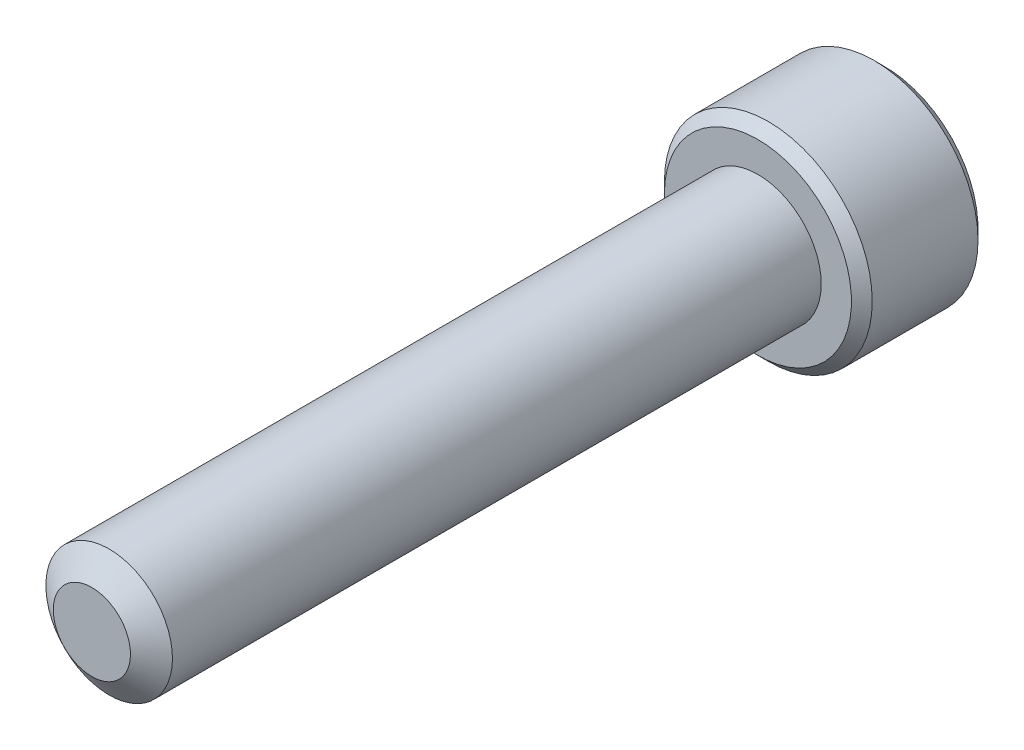
from build123d import *

# Parameters (mm, degrees)
SKETCH1_R            = 2.413
EXTRUDE1_DEPTH       = 25.4
SKETCH6_R            = 3.9624
EXTRUDE2_DEPTH       = 4.826
CUT_EXTRUDE1_DEPTH   = 2.9765625
CHAMFER1_SIZE        = 0.39624
SKETCH10_R           = 2.413
PARTIAL_THREAD_DEPTH = 3.175
CHAMFER2_SIZE        = 0.09652


with BuildPart() as part:
    # Sketch1 → Extrude1 (new body)
    with BuildSketch(Plane.XY):
        Circle(SKETCH1_R)
    extrude(amount=-EXTRUDE1_DEPTH)

    # Sketch4 → Cut-Revolve1 (revolve, cut)
    with BuildSketch(Plane(origin=(0, 0, 0), x_dir=(0, 0, -1), z_dir=(1, 0, 0)), mode=Mode.PRIVATE) as cut_revolve1_sk:
        Polygon((0.659180743, 2.413), (0, 1.471592336), (0, 2.413), align=None)
    revolve(cut_revolve1_sk.sketch.rotate(Axis((0, 0, 0), (0, 0, -1)), 90), axis=Axis((0, 0, 0), (0, 0, -1)), mode=Mode.SUBTRACT)

    # Sketch6 → Extrude2 (add)
    with BuildSketch(Plane(origin=(0, 0, -25.4), x_dir=(-1, 0, 0), z_dir=(0, 0, -1))):
        Circle(SKETCH6_R)
    extrude(amount=EXTRUDE2_DEPTH)

    # Sketch7 → Cut-Extrude1 (cut)
    with BuildSketch(Plane(origin=(0, 0, -30.226), x_dir=(-1, 0, 0), z_dir=(0, 0, -1))):
        Polygon((0, 2.291358881), (-1.984375, 1.14567944), (-1.984375, -1.14567944), (0, -2.291358881), (1.984375, -1.14567944), (1.984375, 1.14567944), align=None)
    extrude(amount=-CUT_EXTRUDE1_DEPTH, mode=Mode.SUBTRACT)

    # Cut-Extrude2 cone 1 section (through the dimple's axis) → Cut-Extrude2 (revolve, cut)
    with BuildSketch(Plane(origin=(0, 0, -30.226), x_dir=(0, 1, 0), z_dir=(1, 0, 0))):
        Polygon((0, 0), (2.291358881, 0), (0, 2.291358881), align=None)
    revolve(axis=Axis((0, 0, -30.226), (0, 0, 1)), mode=Mode.SUBTRACT)

    # Chamfer1
    chamfer1_edges = [part.edges().sort_by_distance(p)[0] for p in [
        (3.9624, 0, -25.4),
        (3.9624, 0, -30.226),
    ]]
    chamfer(chamfer1_edges, length=CHAMFER1_SIZE)


with BuildPart() as body_2:
    # Sketch10 → partial thread (new body)
    with BuildSketch(Plane.XY.offset(-25.4)):
        Circle(SKETCH10_R)
    extrude(amount=PARTIAL_THREAD_DEPTH)

    # Chamfer2
    chamfer2_edges = [body_2.edges().sort_by_distance(p)[0] for p in [
        (-2.413, 0, -22.225),
    ]]
    chamfer(chamfer2_edges, length=CHAMFER2_SIZE)


with BuildPart() as part_1:
    add(part.part)

    # Combine1: union body 2
    add(body_2.part)


solid = part_1.part
